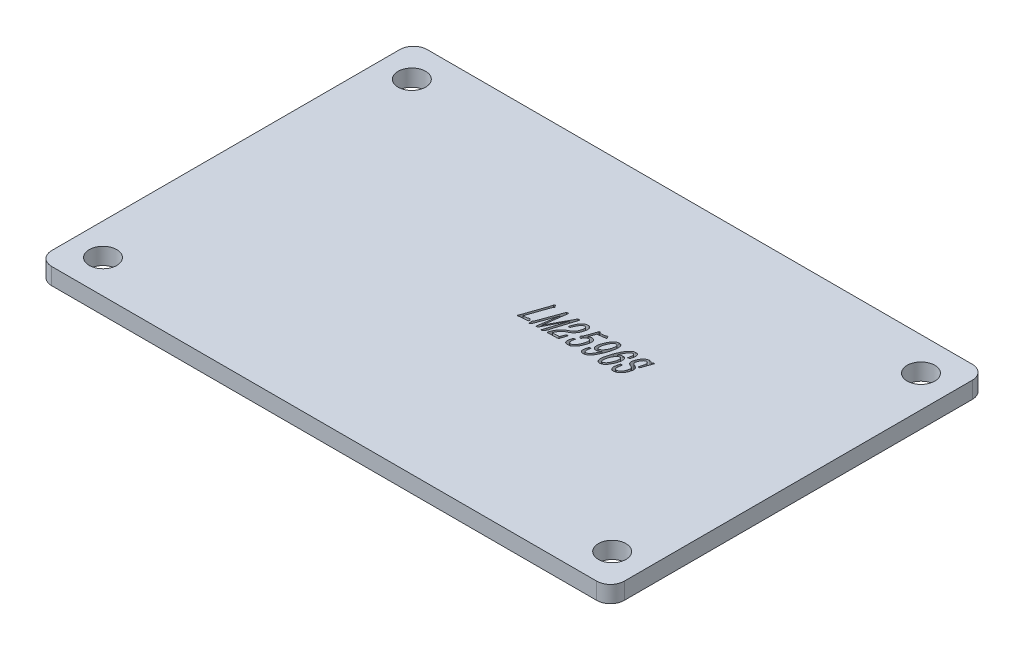
from build123d import *

# Parameters (mm, degrees)
SKETCH_1_R          = 1.65
EXTRUDE_1_DEPTH     = 2
CUT_EXTRUDE_START   = -1
CUT_EXTRUDE_1_DEPTH = 1


# Read off the part's stored shape, not the designer's step: 切除-拉伸1
with BuildPart() as part:
    # 草图1 → 凸台-拉伸1 (new body)
    with BuildSketch(Plane(origin=(0, 0, 0), x_dir=(1, 0, 0), z_dir=(0, 1, 0))):
        with BuildLine():
            Line((32.65, -22.5), (-32.65, -22.5))
            ThreePointArc((-32.65, -22.5), (-33.816726189, -22.016726189), (-34.3, -20.85))
            Line((-34.3, -20.85), (-34.3, 20.85))
            ThreePointArc((-34.3, 20.85), (-33.816726189, 22.016726189), (-32.65, 22.5))
            Line((-32.65, 22.5), (32.65, 22.5))
            ThreePointArc((32.65, 22.5), (33.816726189, 22.016726189), (34.3, 20.85))
            Line((34.3, 20.85), (34.3, -20.85))
            ThreePointArc((34.3, -20.85), (33.816726189, -22.016726189), (32.65, -22.5))
        make_face()
        with Locations(Location((-30.5, 18.5, 0), (0, 0, 270))):
            Circle(SKETCH_1_R, mode=Mode.SUBTRACT)
        with Locations(Location((30.5, 18.5, 0), (0, 0, 90))):
            Circle(SKETCH_1_R, mode=Mode.SUBTRACT)
        with Locations(Location((30.5, -18.5, 0), (0, 0, 270))):
            Circle(SKETCH_1_R, mode=Mode.SUBTRACT)
        with Locations(Location((-30.5, -18.5, 0), (0, 0, 90))):
            Circle(SKETCH_1_R, mode=Mode.SUBTRACT)
    extrude(amount=EXTRUDE_1_DEPTH)

    # 切除-拉伸1 outline → 切除-拉伸1 (cut)
    # profile 1 of 7: a face of its own
    with BuildSketch(Plane(origin=(0, 2, 0), x_dir=(1, 0, 0), z_dir=(0, 1, 0)).offset(CUT_EXTRUDE_START)):
        with BuildLine():
            add(Edge.make_bspline(
                [(11.319624973, 2.529725123), (11.326753338, 2.567830624), (11.339981513, 2.638543373), (11.363810052, 2.738810386), (11.386747264, 2.83309971), (11.402493277, 2.928406503), (11.408788686, 3.024022456), (11.40107061, 3.101456515), (11.384715065, 3.156938358), (11.369804851, 3.194089384), (11.348293758, 3.225207318), (11.322963493, 3.250684221), (11.294296694, 3.270288272), (11.263524636, 3.284015152), (11.230211949, 3.291074833), (11.184684427, 3.290006717), (11.129135658, 3.280496298), (11.076013715, 3.25837237), (11.034406929, 3.229718869), (10.996101664, 3.199008787), (10.95262477, 3.156252878), (10.901523079, 3.105345591), (10.847119389, 3.043543935), (10.792558439, 2.971198575), (10.736915044, 2.889534868), (10.664019856, 2.766635878), (10.576158329, 2.602847504), (10.499771775, 2.433051534), (10.445727973, 2.301323215), (10.421585689, 2.239116022), (10.410345271, 2.210525074)],
                knots=[0, 0, 0, 0, 0.048016888, 0.089105405, 0.127654772, 0.168210064, 0.208611881, 0.246125029, 0.263765638, 0.280183723, 0.295474126, 0.310282398, 0.324462469, 0.338252576, 0.351782306, 0.366256964, 0.394408992, 0.421179489, 0.436725185, 0.456877911, 0.481929832, 0.512200465, 0.546242109, 0.583815889, 0.624389886, 0.668597469, 0.76077153, 0.854490538, 0.899099648, 0.93715592, 0.93715592, 0.93715592, 0.93715592], degree=3))
            Line((11.319624973, 2.529725123), (11.486682293, 2.553590454))
            Line((11.486682293, 2.553590454), (11.542616663, 2.577455785))
            Line((11.542616663, 2.577455785), (11.59705945, 2.735563605))
            add(Edge.make_bspline(
                [(11.300980183, 3.558171745), (11.332938296, 3.55537961), (11.391604224, 3.55025405), (11.470752634, 3.530082967), (11.533066183, 3.499358127), (11.576123996, 3.457009642), (11.604543879, 3.412414193), (11.628279189, 3.371220088), (11.645918441, 3.332653625), (11.656575541, 3.294841352), (11.663922251, 3.255421395), (11.665904063, 3.210409655), (11.667264725, 3.158391127), (11.663279952, 3.101732242), (11.660194196, 3.045264039), (11.655589125, 2.993299452), (11.650667761, 2.948240187), (11.642153035, 2.894323663), (11.626748851, 2.823432882), (11.607663016, 2.766946106), (11.59705945, 2.735563605)],
                knots=[0, 0, 0, 0, 0.091586168, 0.168125935, 0.232336966, 0.287622003, 0.338278218, 0.383145194, 0.423552602, 0.459085297, 0.495189033, 0.537922916, 0.587673765, 0.643887342, 0.700141333, 0.749361491, 0.792995872, 0.829682411, 0.905376226, 1, 1, 1, 1], degree=3))
            add(Edge.make_bspline(
                [(10.078627743, 2.088962284), (10.092043775, 2.124514194), (10.117212009, 2.191208933), (10.152737815, 2.284990134), (10.185663794, 2.365405537), (10.225197569, 2.458460171), (10.279164702, 2.571015442), (10.346529938, 2.7098071), (10.422825779, 2.84851108), (10.4891655, 2.962189864), (10.547655064, 3.05014134), (10.597371436, 3.11763489), (10.654008389, 3.186987801), (10.714203242, 3.258491084), (10.779252353, 3.326433394), (10.846166624, 3.388282473), (10.915212273, 3.440367594), (10.984767437, 3.48551032), (11.058000786, 3.520567517), (11.135394035, 3.544224908), (11.216917438, 3.558489113), (11.272581603, 3.55827896), (11.300980183, 3.558171745)],
                knots=[0, 0, 0, 0, 0.056410835, 0.105825706, 0.14886341, 0.185400755, 0.255897094, 0.334127727, 0.414387224, 0.490842857, 0.529430594, 0.571134342, 0.615225599, 0.662339254, 0.709844425, 0.754777107, 0.797439761, 0.838085033, 0.877703722, 0.91750761, 0.957914275, 1, 1, 1, 1], degree=3))
            add(Edge.make_bspline(
                [(10.220328148, 0.281909227), (10.19249915, 0.280098745), (10.138454152, 0.276582721), (10.070837234, 0.287224422), (10.020300058, 0.307853057), (9.981584961, 0.329435729), (9.942445068, 0.358703245), (9.902806204, 0.393420868), (9.86591267, 0.435175841), (9.837901593, 0.485120934), (9.814521026, 0.539843172), (9.797351744, 0.623039326), (9.785413991, 0.73268396), (9.780797995, 0.847487699), (9.785600824, 0.948152915), (9.796865384, 1.037662616), (9.813201733, 1.140700776), (9.835695491, 1.251967632), (9.860700878, 1.361489032), (9.881452444, 1.45999998), (9.901360112, 1.541057249), (9.921795449, 1.627581379), (9.950036536, 1.724331764), (9.987162506, 1.839703457), (10.030604097, 1.961317245), (10.06209135, 2.045009175), (10.078627743, 2.088962284)],
                knots=[0, 0, 0, 0, 0.03956068, 0.07682838, 0.095843058, 0.116866224, 0.139607214, 0.165118082, 0.191658894, 0.218244295, 0.246111869, 0.275832629, 0.33841793, 0.402715898, 0.438774703, 0.481433334, 0.530775575, 0.586935239, 0.642621152, 0.690341085, 0.729908068, 0.761166336, 0.816603174, 0.872993246, 0.933298924, 1, 1, 1, 1], degree=3))
            add(Edge.make_bspline(
                [(11.068293203, 1.084380993), (11.053872372, 1.05541355), (11.023329038, 0.994060479), (10.969919402, 0.900045656), (10.909148123, 0.797266792), (10.842698841, 0.689580228), (10.77067729, 0.585020153), (10.689912589, 0.496193855), (10.604071033, 0.425272911), (10.514549478, 0.373835141), (10.428409541, 0.337241697), (10.350739054, 0.30914977), (10.282885658, 0.289066112), (10.239814747, 0.284138589), (10.220328148, 0.281909227)],
                knots=[0, 0, 0, 0, 0.079263847, 0.167880907, 0.264814542, 0.371790082, 0.477921398, 0.575347443, 0.664953156, 0.749565857, 0.827301008, 0.893958514, 0.952023584, 1, 1, 1, 1], degree=3))
            add(Edge.make_bspline(
                [(10.866929469, 2.42158534), (10.886589109, 2.42118425), (10.924292828, 2.420415029), (10.978317607, 2.413823439), (11.027127036, 2.402341257), (11.0704245, 2.384465457), (11.110126107, 2.363025804), (11.145250427, 2.334657677), (11.177822239, 2.301762803), (11.206196623, 2.262416031), (11.230840866, 2.217275717), (11.251560663, 2.166182107), (11.268932178, 2.109090825), (11.285125994, 2.024054569), (11.296537056, 1.911174741), (11.289262569, 1.794565371), (11.274634537, 1.697461188), (11.256960519, 1.617881049), (11.23389369, 1.53225165), (11.19483815, 1.411518301), (11.141690833, 1.260480826), (11.092451101, 1.142342016), (11.068293203, 1.084380993)],
                knots=[0, 0, 0, 0, 0.036382012, 0.069774277, 0.100580197, 0.128866596, 0.156266865, 0.183794371, 0.212106964, 0.241746136, 0.273258923, 0.307101626, 0.343643368, 0.383535045, 0.467197852, 0.552918689, 0.598998486, 0.648914818, 0.703726948, 0.763108811, 0.883776925, 1, 1, 1, 1], degree=3))
            add(Edge.make_bspline(
                [(10.410345271, 2.210525074), (10.416050186, 2.215819905), (10.449129723, 2.245792172), (10.515387249, 2.296635031), (10.596944633, 2.34739101), (10.669961017, 2.38141985), (10.730958103, 2.401452348), (10.797361446, 2.414729849), (10.843260597, 2.419252922), (10.866929469, 2.42158534)],
                knots=[0.404971471, 0.404971471, 0.404971471, 0.404971471, 0.432023627, 0.560128766, 0.694717093, 0.765101066, 0.83971451, 0.917345382, 1, 1, 1, 1], degree=3))
        make_face()
        with BuildLine():
            add(Edge.make_bspline(
                [(10.78340081, 2.144150863), (10.773100017, 2.142556458), (10.750618648, 2.139076688), (10.716027357, 2.124014401), (10.676728769, 2.104229335), (10.61950773, 2.068122267), (10.549209543, 2.014286204), (10.485947564, 1.949276583), (10.438225331, 1.889966685), (10.402168059, 1.836055129), (10.362124324, 1.775401551), (10.32250004, 1.70543497), (10.282350459, 1.628120598), (10.242879966, 1.544201096), (10.20537119, 1.453333549), (10.182767084, 1.390009052), (10.171105902, 1.35734072)],
                knots=[0, 0, 0, 0, 0.030109941, 0.065714622, 0.108588335, 0.157792871, 0.261597461, 0.364557771, 0.419941904, 0.482122806, 0.552499195, 0.630638236, 0.715103682, 0.805067532, 0.89943673, 1, 1, 1, 1], degree=3))
            add(Edge.make_bspline(
                [(10.994459834, 1.706371191), (10.996023434, 1.727987763), (10.999094338, 1.770442601), (10.998155227, 1.83301138), (10.993304701, 1.893197713), (10.982810117, 1.949506966), (10.969352689, 2.000724278), (10.95159455, 2.044118522), (10.930889814, 2.079967855), (10.905013561, 2.106412307), (10.876785311, 2.125274258), (10.847149319, 2.138714329), (10.815442897, 2.144403173), (10.79410278, 2.144235134), (10.78340081, 2.144150863)],
                knots=[0, 0, 0, 0, 0.117814531, 0.231387145, 0.339957123, 0.445764662, 0.542521874, 0.627383564, 0.700188791, 0.766158301, 0.826528991, 0.884046869, 0.941850039, 1, 1, 1, 1], degree=3))
            add(Edge.make_bspline(
                [(10.261346687, 0.559343703), (10.277116988, 0.561036132), (10.310050452, 0.564570469), (10.359697313, 0.581371719), (10.411370211, 0.606364875), (10.464387545, 0.639656708), (10.516258175, 0.68049559), (10.566448783, 0.725344467), (10.611522599, 0.776372283), (10.667831669, 0.851112799), (10.731329902, 0.95619793), (10.795934626, 1.094643622), (10.855107472, 1.241413379), (10.915663077, 1.390752272), (10.967307612, 1.545247184), (10.985397457, 1.652594138), (10.994459834, 1.706371191)],
                knots=[0, 0, 0, 0, 0.033065291, 0.069050969, 0.108790502, 0.152905102, 0.19956824, 0.246646067, 0.293375687, 0.341592316, 0.442107469, 0.549241177, 0.660589479, 0.772799957, 0.88618076, 1, 1, 1, 1], degree=3))
            add(Edge.make_bspline(
                [(10.171105902, 1.35734072), (10.157214891, 1.313537581), (10.128946777, 1.22439849), (10.099911739, 1.087160277), (10.082936778, 0.949425392), (10.081717538, 0.837543122), (10.089357472, 0.754881106), (10.09924336, 0.701098577), (10.115046922, 0.655622102), (10.133766577, 0.617106754), (10.158955138, 0.587815623), (10.18889873, 0.567377888), (10.224199621, 0.557126412), (10.248618264, 0.55858395), (10.261346687, 0.559343703)],
                knots=[0, 0, 0, 0, 0.152325287, 0.309980926, 0.464393534, 0.611968529, 0.679892627, 0.739554139, 0.792740957, 0.839202455, 0.880695047, 0.919337794, 0.957954149, 1, 1, 1, 1], degree=3))
        make_face(mode=Mode.SUBTRACT)
    # profile 2 of 7: a face of its own
    with BuildSketch(Plane(origin=(0, 2, 0), x_dir=(1, 0, 0), z_dir=(0, 1, 0)).offset(CUT_EXTRUDE_START)):
        with BuildLine():
            add(Edge.make_bspline(
                [(12.912635841, 3.567867036), (12.939142799, 3.565233706), (12.990134196, 3.560167972), (13.061479373, 3.539212889), (13.125736341, 3.511504093), (13.179321881, 3.472634465), (13.224573033, 3.431830655), (13.258620007, 3.394250591), (13.275885689, 3.369629077), (13.28190395, 3.359344784)],
                knots=[0, 0, 0, 0, 0.160913397, 0.309548871, 0.448301289, 0.582320695, 0.708056454, 0.8167907, 0.888918404, 0.888918404, 0.888918404, 0.888918404], degree=3))
            add(Edge.make_bspline(
                [(12.028872789, 2.730343064), (12.037961875, 2.756585471), (12.05554781, 2.807360352), (12.086989767, 2.878979592), (12.11750693, 2.945449357), (12.162163511, 3.025869263), (12.224268655, 3.12064819), (12.306016893, 3.227829835), (12.393614077, 3.323941803), (12.484290088, 3.405999762), (12.578963013, 3.471260438), (12.661240331, 3.516590821), (12.73159073, 3.543940104), (12.788797484, 3.557595487), (12.849411885, 3.567266944), (12.891215329, 3.567663723), (12.912635841, 3.567867036)],
                knots=[0, 0, 0, 0, 0.064498195, 0.12479374, 0.181637338, 0.234373753, 0.338350867, 0.444636662, 0.547250782, 0.640116115, 0.728083073, 0.81387459, 0.857749845, 0.902998931, 0.950295664, 1, 1, 1, 1], degree=3))
            add(Edge.make_bspline(
                [(12.213829107, 1.920413382), (12.18380199, 1.935425676), (12.124665966, 1.964991197), (12.061289845, 2.0182297), (12.019942917, 2.06725959), (11.994543204, 2.10732764), (11.973202676, 2.150129614), (11.957629324, 2.196825794), (11.947181788, 2.247139404), (11.942356007, 2.301149805), (11.941503127, 2.358766382), (11.94621769, 2.42089776), (11.956966845, 2.488708612), (11.974384709, 2.5631426), (11.998467725, 2.64475035), (12.018397516, 2.700854323), (12.028872789, 2.730343064)],
                knots=[0, 0, 0, 0, 0.107404064, 0.211523776, 0.262460483, 0.312661898, 0.363291962, 0.415479857, 0.470049255, 0.527721881, 0.589115285, 0.654664533, 0.727279933, 0.809086455, 0.899654161, 1, 1, 1, 1], degree=3))
            Line((12.213829107, 1.920413382), (12.398039633, 1.841359472))
            add(Edge.make_bspline(
                [(12.585233326, 1.240251438), (12.594400313, 1.274448647), (12.611296104, 1.33747796), (12.62795106, 1.425432934), (12.636008327, 1.498379763), (12.633269717, 1.558239262), (12.622779176, 1.608147262), (12.608581966, 1.652170455), (12.587575031, 1.690922305), (12.562719839, 1.726194961), (12.531116406, 1.757888149), (12.493380693, 1.787946863), (12.448445071, 1.816124798), (12.415345898, 1.832695368), (12.398039633, 1.841359472)],
                knots=[0, 0, 0, 0, 0.149796169, 0.276091238, 0.378589772, 0.459715849, 0.528429664, 0.593977199, 0.65469369, 0.714259707, 0.776015707, 0.843387247, 0.918113307, 1, 1, 1, 1], degree=3))
            add(Edge.make_bspline(
                [(11.931174089, 0.574259535), (11.95160895, 0.574956763), (11.991801323, 0.576328107), (12.050331783, 0.58771282), (12.10533799, 0.6066983), (12.15778136, 0.632425154), (12.207284117, 0.665796263), (12.256453349, 0.704089904), (12.304001843, 0.748899201), (12.363583365, 0.815241572), (12.430281098, 0.898970165), (12.494124356, 1.005113843), (12.545134858, 1.117985543), (12.571358469, 1.197945037), (12.585233326, 1.240251438)],
                knots=[0, 0, 0, 0, 0.06157663, 0.121112194, 0.178948509, 0.236604839, 0.296685232, 0.358612133, 0.424367126, 0.493341319, 0.627383728, 0.746417103, 0.865829817, 1, 1, 1, 1], degree=3))
            add(Edge.make_bspline(
                [(11.776795227, 1.46398892), (11.768461383, 1.425980908), (11.752797092, 1.354541058), (11.732683638, 1.253544708), (11.716322288, 1.165770154), (11.699399386, 1.069455772), (11.687113395, 0.964430817), (11.688733634, 0.867064956), (11.697142974, 0.79769926), (11.708995673, 0.75251395), (11.722406268, 0.711364334), (11.740619482, 0.675611471), (11.760390674, 0.644836582), (11.782109829, 0.620379129), (11.803881566, 0.600607911), (11.835200511, 0.58383917), (11.878312409, 0.573425255), (11.913231895, 0.573976366), (11.931174089, 0.574259535)],
                knots=[0, 0, 0, 0, 0.112864024, 0.212139198, 0.298694179, 0.371837857, 0.495825715, 0.604731979, 0.653479027, 0.698076056, 0.740035884, 0.7787337, 0.814133331, 0.845812142, 0.873421557, 0.898915982, 0.948061405, 1, 1, 1, 1], degree=3))
            Line((11.776795227, 1.46398892), (11.570956744, 1.46398892))
            Line((11.570956744, 1.46398892), (11.482207543, 1.151502237))
            add(Edge.make_bspline(
                [(11.846153846, 0.291604517), (11.821507506, 0.291672515), (11.774402182, 0.291802474), (11.707229629, 0.302668781), (11.647908365, 0.323792617), (11.596166803, 0.353871173), (11.552693807, 0.393226045), (11.514008461, 0.437883281), (11.483088935, 0.490364957), (11.45641734, 0.548064989), (11.437405549, 0.612114312), (11.425614494, 0.681715451), (11.420595756, 0.756164709), (11.423124823, 0.861840183), (11.43937617, 0.995682807), (11.468003001, 1.099826479), (11.482207543, 1.151502237)],
                knots=[0, 0, 0, 0, 0.066209553, 0.126543031, 0.181941951, 0.234679622, 0.286308345, 0.338948483, 0.392946326, 0.449486953, 0.509545765, 0.57196873, 0.638979959, 0.709851081, 0.856029028, 1, 1, 1, 1], degree=3))
            add(Edge.make_bspline(
                [(12.716492649, 0.886746218), (12.690673631, 0.843535161), (12.639155802, 0.757314228), (12.560012956, 0.660765442), (12.494157344, 0.590048647), (12.446439371, 0.542235389), (12.400473609, 0.499550612), (12.354670103, 0.462173232), (12.307160045, 0.427820804), (12.25390394, 0.397983566), (12.195658355, 0.36856258), (12.132248815, 0.342013207), (12.064574224, 0.319473968), (11.993939972, 0.303210907), (11.920780395, 0.293064213), (11.871295667, 0.292096292), (11.846153846, 0.291604517)],
                knots=[0, 0, 0, 0, 0.136340092, 0.272045418, 0.337393071, 0.398407192, 0.455181305, 0.507402547, 0.558653188, 0.613922574, 0.672710074, 0.735558621, 0.800150866, 0.865886795, 0.931860792, 1, 1, 1, 1], degree=3))
            add(Edge.make_bspline(
                [(12.603878116, 2.121777115), (12.625624731, 2.110055924), (12.666928449, 2.087793665), (12.723661478, 2.052989545), (12.771789988, 2.018606704), (12.823834543, 1.974915948), (12.876279106, 1.915606015), (12.913094756, 1.847682595), (12.93267358, 1.790038621), (12.943825739, 1.74470064), (12.947642368, 1.696750531), (12.947439011, 1.629122814), (12.93803875, 1.540489915), (12.922539072, 1.449199842), (12.903377024, 1.372394865), (12.887292499, 1.308688575), (12.865934129, 1.241147333), (12.835749131, 1.144635294), (12.79080682, 1.023351055), (12.741226002, 0.932211244), (12.716492649, 0.886746218)],
                knots=[0, 0, 0, 0, 0.051978856, 0.098724335, 0.139954766, 0.176325786, 0.241579757, 0.305248117, 0.337342347, 0.369572714, 0.403199264, 0.438248371, 0.511800373, 0.590407898, 0.632912887, 0.678337143, 0.72864387, 0.781914954, 0.891208439, 1, 1, 1, 1], degree=3))
            Line((12.603878116, 2.121777115), (12.451736629, 2.191881526))
            add(Edge.make_bspline(
                [(12.251864479, 2.420839548), (12.25546024, 2.402259087), (12.262116354, 2.367864795), (12.280672021, 2.321957054), (12.302840436, 2.284124567), (12.341964771, 2.250166174), (12.392119568, 2.220779682), (12.432728901, 2.201095135), (12.451736629, 2.191881526)],
                knots=[0, 0, 0, 0, 0.175867707, 0.325548712, 0.459851584, 0.579514817, 0.803186428, 1, 1, 1, 1], degree=3))
            add(Edge.make_bspline(
                [(12.827615598, 3.290432559), (12.817908102, 3.289873934), (12.796811475, 3.288659913), (12.768800737, 3.283484538), (12.742880056, 3.273587179), (12.717635925, 3.261203579), (12.687516093, 3.243071278), (12.638434899, 3.211799257), (12.573729795, 3.160269146), (12.503974029, 3.081081866), (12.440608573, 2.992377615), (12.393744172, 2.913555877), (12.361985839, 2.845783376), (12.33736252, 2.789834611), (12.312076152, 2.727980931), (12.287128503, 2.662429917), (12.266514629, 2.596339869), (12.252249856, 2.533358423), (12.24732849, 2.475025625), (12.250408657, 2.438230529), (12.251864479, 2.420839548)],
                knots=[0, 0, 0, 0, 0.02615902, 0.056849589, 0.07610501, 0.100631584, 0.132403363, 0.17061691, 0.257201114, 0.353786648, 0.453453338, 0.550260886, 0.599916659, 0.654714876, 0.714699339, 0.779666327, 0.843339964, 0.900791803, 0.953109843, 1, 1, 1, 1], degree=3))
            add(Edge.make_bspline(
                [(13.052844662, 2.761666312), (13.058173498, 2.789455577), (13.067940833, 2.840391112), (13.076337384, 2.910439693), (13.082173791, 2.966656911), (13.080289229, 3.022987276), (13.06815402, 3.08223188), (13.044263646, 3.146477292), (13.006166289, 3.203274921), (12.955389906, 3.248171568), (12.895185746, 3.281983749), (12.850160063, 3.287613653), (12.827615598, 3.290432559)],
                knots=[0, 0, 0, 0, 0.128213972, 0.235006107, 0.319796701, 0.384071856, 0.489716169, 0.592471914, 0.693117255, 0.796064391, 0.897888965, 1, 1, 1, 1], degree=3))
            Line((13.052844662, 2.761666312), (12.895482634, 2.19859365))
            Line((12.895482634, 2.19859365), (13.099083742, 2.211272107))
            Line((13.099083742, 2.211272107), (13.553270829, 3.524611123))
            Line((13.553270829, 3.524611123), (13.373535052, 3.539526955))
            Line((13.373535052, 3.539526955), (13.28190395, 3.359344784))
        make_face()
    # profile 3 of 7: a face of its own
    with BuildSketch(Plane(origin=(0, 2, 0), x_dir=(1, 0, 0), z_dir=(0, 1, 0)).offset(CUT_EXTRUDE_START)):
        with BuildLine():
            add(Edge.make_bspline(
                [(4.518751332, 2.1941189), (4.52742417, 2.224704013), (4.543586905, 2.281702542), (4.56654992, 2.361132264), (4.587435472, 2.42793498), (4.611929362, 2.503501881), (4.646526277, 2.594316086), (4.67664378, 2.666295228), (4.692520776, 2.704240358)],
                knots=[0, 0, 0, 0, 0.176806308, 0.329496897, 0.459810584, 0.566052454, 0.77123656, 1, 1, 1, 1], degree=3))
            Line((4.518751332, 2.1941189), (4.694012359, 2.217984232))
            Line((4.694012359, 2.217984232), (4.748455146, 2.241103772))
            Line((4.748455146, 2.241103772), (4.808118474, 2.402194758))
            add(Edge.make_bspline(
                [(5.501704667, 3.241210313), (5.482379308, 3.240757185), (5.439944116, 3.239762191), (5.374292699, 3.21333138), (5.303012143, 3.170582731), (5.227738787, 3.109611004), (5.150875726, 3.032289377), (5.078006004, 2.936860027), (5.006798145, 2.824648378), (4.936411066, 2.696335254), (4.86826172, 2.554061095), (4.828402329, 2.453413057), (4.808118474, 2.402194758)],
                knots=[0, 0, 0, 0, 0.050563255, 0.111028292, 0.18322451, 0.269416453, 0.365243966, 0.469747148, 0.584883573, 0.714985691, 0.85496043, 1, 1, 1, 1], degree=3))
            add(Edge.make_bspline(
                [(5.700085233, 2.843703388), (5.702760308, 2.870021391), (5.707874552, 2.920336507), (5.70832801, 2.99333408), (5.700560048, 3.059541133), (5.688387067, 3.11918998), (5.665665647, 3.172021345), (5.623381091, 3.210604938), (5.567076911, 3.234856875), (5.524595988, 3.238985537), (5.501704667, 3.241210313)],
                knots=[0, 0, 0, 0, 0.154058382, 0.294530913, 0.424229108, 0.541566664, 0.649092709, 0.752563447, 0.866666044, 1, 1, 1, 1], degree=3))
            add(Edge.make_bspline(
                [(5.119113573, 1.891327509), (5.137899638, 1.901021344), (5.174046093, 1.919673349), (5.223813272, 1.950516435), (5.268579282, 1.980772805), (5.308239823, 2.014571505), (5.347364494, 2.053553536), (5.387403985, 2.102337589), (5.429373945, 2.162612276), (5.490308836, 2.254276533), (5.559846289, 2.376167772), (5.624751363, 2.528763989), (5.6732433, 2.683894653), (5.691103931, 2.790231434), (5.700085233, 2.843703388)],
                knots=[0, 0, 0, 0, 0.05476668, 0.105377116, 0.151669174, 0.194650271, 0.240210143, 0.294657526, 0.357948043, 0.430501334, 0.579948825, 0.72081211, 0.859609046, 1, 1, 1, 1], degree=3))
            Line((5.119113573, 1.891327509), (4.873002344, 1.763051353))
            add(Edge.make_bspline(
                [(4.026528873, 0.838269763), (4.053436719, 0.893321497), (4.104223711, 0.99722844), (4.186161234, 1.13827915), (4.266099643, 1.256681798), (4.346582779, 1.351995827), (4.424112839, 1.429631638), (4.494949772, 1.497370541), (4.560862148, 1.554686162), (4.642469506, 1.617984485), (4.745186989, 1.687597609), (4.829968468, 1.737646995), (4.873002344, 1.763051353)],
                knots=[0, 0, 0, 0, 0.143839333, 0.271488367, 0.382722806, 0.478837322, 0.563869028, 0.640256739, 0.708952998, 0.768852387, 0.882672751, 1, 1, 1, 1], degree=3))
            add(Edge.make_bspline(
                [(3.969848711, 0.331131472), (3.958861911, 0.330771559), (3.939028006, 0.330121826), (3.912017273, 0.337515829), (3.891466092, 0.352157542), (3.880298429, 0.376235534), (3.878830794, 0.407793192), (3.882801393, 0.448523238), (3.89595605, 0.499146405), (3.921493786, 0.582842534), (3.965870906, 0.697211517), (4.00584785, 0.790176677), (4.026528873, 0.838269763)],
                knots=[0, 0, 0, 0, 0.055062309, 0.09940116, 0.138686278, 0.177851686, 0.228145004, 0.295993015, 0.383390618, 0.490642207, 0.736497112, 1, 1, 1, 1], degree=3))
            Line((3.969848711, 0.331131472), (4.955785212, 0.355742595))
            add(Edge.make_bspline(
                [(5.265288728, 0.553377371), (5.261278348, 0.539966515), (5.254294301, 0.516611612), (5.245518009, 0.485792342), (5.238170034, 0.465080135), (5.231479678, 0.446252079), (5.213569852, 0.425065122), (5.193249486, 0.396911338), (5.156182621, 0.373587741), (5.105742147, 0.364690038), (5.037665859, 0.35589756), (4.98518622, 0.355798239), (4.955785212, 0.355742595)],
                knots=[0, 0, 0, 0, 0.100483591, 0.174991401, 0.22972114, 0.258544779, 0.317448375, 0.426207677, 0.506394728, 0.62409379, 0.789403632, 1, 1, 1, 1], degree=3))
            Line((5.265288728, 0.553377371), (5.480822502, 1.251438312))
            Line((5.480822502, 1.251438312), (5.273492436, 1.251438312))
            Line((5.273492436, 1.251438312), (5.091519284, 0.786064351))
            add(Edge.make_bspline(
                [(5.012465374, 0.642872363), (5.015280268, 0.643394819), (5.020563987, 0.6443755), (5.028521261, 0.650370967), (5.034430882, 0.666113687), (5.04811039, 0.691825755), (5.067938047, 0.733654665), (5.082897328, 0.766901914), (5.091519284, 0.786064351)],
                knots=[0, 0, 0, 0, 0.050886524, 0.095516957, 0.171388695, 0.345046395, 0.622509892, 1, 1, 1, 1], degree=3))
            Line((5.012465374, 0.642872363), (4.21595994, 0.614532282))
            Line((4.21595994, 0.614532282), (4.280098018, 0.772640102))
            add(Edge.make_bspline(
                [(4.915512465, 1.508736416), (4.886179417, 1.492742657), (4.827048838, 1.460501882), (4.742868179, 1.40457342), (4.662415969, 1.34381028), (4.591968595, 1.273672462), (4.528541807, 1.198981821), (4.468398884, 1.120471794), (4.412177336, 1.03414168), (4.359633601, 0.943454614), (4.313400772, 0.85614754), (4.29038255, 0.798428807), (4.280098018, 0.772640102)],
                knots=[0, 0, 0, 0, 0.100736605, 0.203068347, 0.304619499, 0.404315168, 0.502166149, 0.60010617, 0.702437912, 0.812664409, 0.91629854, 1, 1, 1, 1], degree=3))
            Line((4.915512465, 1.508736416), (5.22427019, 1.668335819))
            add(Edge.make_bspline(
                [(5.814191349, 2.308970808), (5.791326086, 2.265279153), (5.74440479, 2.175620482), (5.660051753, 2.049790865), (5.569560284, 1.933450682), (5.486922509, 1.848915338), (5.415063521, 1.792483145), (5.357403798, 1.750233432), (5.293240909, 1.7087072), (5.247746119, 1.68207724), (5.22427019, 1.668335819)],
                knots=[0, 0, 0, 0, 0.166927441, 0.34254808, 0.512188802, 0.665802747, 0.741285181, 0.821454804, 0.907868257, 1, 1, 1, 1], degree=3))
            add(Edge.make_bspline(
                [(5.599403367, 3.538781163), (5.621606813, 3.537117835), (5.664163567, 3.533929778), (5.724784762, 3.520095975), (5.77974091, 3.500313212), (5.828236662, 3.473041702), (5.871005934, 3.441647552), (5.907828012, 3.406681898), (5.938077474, 3.367773107), (5.963172818, 3.325862973), (5.98165253, 3.278828985), (5.996994737, 3.227832865), (6.005073695, 3.171067425), (6.012231251, 3.090010012), (6.009783094, 2.984777885), (5.991678271, 2.856561809), (5.960244821, 2.722605303), (5.919428998, 2.582902167), (5.872535809, 2.44222348), (5.833237055, 2.352469217), (5.814191349, 2.308970808)],
                knots=[0, 0, 0, 0, 0.044636197, 0.085553007, 0.124390622, 0.161466956, 0.196796398, 0.230676006, 0.263017811, 0.295451868, 0.328347086, 0.364194254, 0.402094164, 0.443159791, 0.527501624, 0.612607545, 0.702668551, 0.803424088, 0.90473166, 1, 1, 1, 1], degree=3))
            add(Edge.make_bspline(
                [(4.692520776, 2.704240358), (4.704829383, 2.733376157), (4.728738936, 2.789972648), (4.765412737, 2.871250639), (4.804124408, 2.945167471), (4.842430538, 3.015645801), (4.887979964, 3.083425056), (4.941301867, 3.153346275), (5.005153812, 3.226019045), (5.075500384, 3.300468462), (5.149721381, 3.37039397), (5.225927168, 3.427121407), (5.299901943, 3.471287233), (5.372992327, 3.498431741), (5.440596807, 3.514994961), (5.500260261, 3.529354022), (5.552450691, 3.537226083), (5.58471661, 3.538294735), (5.599403367, 3.538781163)],
                knots=[0, 0, 0, 0, 0.072714776, 0.141248954, 0.204893109, 0.264509684, 0.325534037, 0.392401429, 0.466539591, 0.547790467, 0.627869174, 0.700563736, 0.765849414, 0.825180425, 0.878964782, 0.925827397, 0.966238217, 1, 1, 1, 1], degree=3))
        make_face()
    # profile 4 of 7: a face of its own
    with BuildSketch(Plane(origin=(0, 2, 0), x_dir=(1, 0, 0), z_dir=(0, 1, 0)).offset(CUT_EXTRUDE_START)):
        with BuildLine():
            add(Edge.make_bspline(
                [(3.759535478, 1.011293416), (3.754922021, 0.998411394), (3.74635742, 0.974496709), (3.736445384, 0.940605878), (3.726816458, 0.912364054), (3.719112619, 0.881013608), (3.713109845, 0.845126386), (3.707546363, 0.804614334), (3.706058766, 0.766926656), (3.707628046, 0.734019354), (3.710731277, 0.705928575), (3.710755684, 0.681837677), (3.700151773, 0.65791386), (3.682268159, 0.628493151), (3.65475747, 0.586082516), (3.632149433, 0.554268415), (3.619326657, 0.536224164)],
                knots=[0, 0, 0, 0, 0.080753431, 0.149913804, 0.20839393, 0.25679974, 0.340280675, 0.42310116, 0.498002039, 0.562639444, 0.617115751, 0.66563266, 0.701877649, 0.769590465, 0.869316836, 1, 1, 1, 1], degree=3))
            Line((3.759535478, 1.011293416), (3.828894098, 1.229064564))
            Line((3.828894098, 1.229064564), (4.577668869, 3.593969742))
            Line((4.577668869, 3.593969742), (4.332303431, 3.593969742))
            Line((4.332303431, 3.593969742), (2.815363307, 0.797251225))
            Line((2.815363307, 0.797251225), (3.200191775, 3.593969742))
            Line((3.200191775, 3.593969742), (2.951097379, 3.593969742))
            Line((2.951097379, 3.593969742), (2.087470701, 1.20370765))
            add(Edge.make_bspline(
                [(1.799595142, 0.566055828), (1.801478516, 0.581109529), (1.805173922, 0.610646704), (1.821543585, 0.653578281), (1.845429282, 0.696107861), (1.875545933, 0.736707605), (1.901000571, 0.773152741), (1.921166344, 0.796774711), (1.931063669, 0.815674908), (1.941339048, 0.833170877), (1.950847183, 0.858589935), (1.964007402, 0.887240928), (1.975192454, 0.917106232), (1.986828891, 0.942058714), (1.994834316, 0.961643085), (2.000845452, 0.975295176), (2.006468186, 0.986958971), (2.010972758, 1.001370544), (2.020147647, 1.020673065), (2.028983008, 1.046375699), (2.040498312, 1.077755243), (2.054689916, 1.114356101), (2.070250625, 1.157244706), (2.081484634, 1.187556135), (2.087470701, 1.20370765)],
                knots=[0, 0, 0, 0, 0.064362733, 0.126287432, 0.194015174, 0.271510944, 0.341137925, 0.383462597, 0.40288704, 0.431768008, 0.469698212, 0.518048477, 0.565991795, 0.60531333, 0.635185225, 0.656027709, 0.668812983, 0.690238215, 0.72011011, 0.759616287, 0.805811297, 0.862408184, 0.926683881, 1, 1, 1, 1], degree=3))
            Line((1.799595142, 0.566055828), (1.811527807, 0.348284679))
            add(Edge.make_bspline(
                [(1.857766887, 0.198380567), (1.851709489, 0.199225064), (1.838525031, 0.201063186), (1.822736888, 0.211024146), (1.814233273, 0.226009088), (1.80992754, 0.242607416), (1.808149201, 0.263963083), (1.808153466, 0.288405989), (1.810231987, 0.311719688), (1.8103767, 0.330155913), (1.811603477, 0.341561625), (1.811544602, 0.346792507), (1.811527807, 0.348284679)],
                knots=[0, 0, 0, 0, 0.103457675, 0.225184737, 0.299006802, 0.391175757, 0.514212532, 0.661916962, 0.805649294, 0.911236827, 0.974679241, 1, 1, 1, 1], degree=3))
            add(Edge.make_bspline(
                [(2.066588536, 0.401981675), (2.057289988, 0.378448997), (2.038176198, 0.330075993), (2.007974543, 0.272172839), (1.975065965, 0.230566669), (1.9416431, 0.209155613), (1.901537391, 0.197425234), (1.873012571, 0.198047815), (1.857766887, 0.198380567)],
                knots=[0, 0, 0, 0, 0.238225779, 0.489689114, 0.612577651, 0.732692637, 0.85713202, 1, 1, 1, 1], degree=3))
            Line((2.066588536, 0.401981675), (2.181440443, 0.707756233))
            Line((2.181440443, 0.707756233), (2.933198381, 2.796718517))
            Line((2.933198381, 2.796718517), (2.552098871, 0.322927765))
            Line((2.552098871, 0.322927765), (2.76539527, 0.31621564))
            Line((2.76539527, 0.31621564), (4.072767952, 2.826550181))
            Line((4.072767952, 2.826550181), (3.391860217, 0.733113147))
            Line((3.391860217, 0.733113147), (3.2956531, 0.427338589))
            add(Edge.make_bspline(
                [(3.244939271, 0.252077562), (3.244076606, 0.259799804), (3.241797935, 0.280197582), (3.251889389, 0.317902753), (3.270134432, 0.368247272), (3.286452101, 0.406032651), (3.2956531, 0.427338589)],
                knots=[0, 0, 0, 0, 0.125565402, 0.331672527, 0.62315202, 1, 1, 1, 1], degree=3))
            add(Edge.make_bspline(
                [(3.505966333, 0.367675261), (3.494455365, 0.352371298), (3.473086616, 0.323961301), (3.441222414, 0.286856075), (3.413111385, 0.257719643), (3.380532249, 0.232438728), (3.340231313, 0.213403669), (3.298816062, 0.211295154), (3.271163782, 0.218107417), (3.255222616, 0.225191195), (3.245742075, 0.237650105), (3.245209847, 0.24721496), (3.244939271, 0.252077562)],
                knots=[0, 0, 0, 0, 0.167159473, 0.310311779, 0.426966479, 0.519877317, 0.66953105, 0.808609623, 0.871260354, 0.917867672, 0.958245383, 1, 1, 1, 1], degree=3))
            Line((3.505966333, 0.367675261), (3.619326657, 0.536224164))
        make_face()
    # profile 5 of 7: a face of its own
    with BuildSketch(Plane(origin=(0, 2, 0), x_dir=(1, 0, 0), z_dir=(0, 1, 0)).offset(CUT_EXTRUDE_START)):
        with BuildLine():
            add(Edge.make_bspline(
                [(8.173130194, 1.330492222), (8.166894798, 1.308621546), (8.155069895, 1.267145657), (8.138549738, 1.208008235), (8.124438148, 1.155602287), (8.108655453, 1.092787365), (8.094295896, 1.01296145), (8.080777408, 0.913586682), (8.079345091, 0.811612797), (8.09436686, 0.730672762), (8.11429414, 0.673670829), (8.132475538, 0.637579853), (8.152126106, 0.606758143), (8.175038714, 0.581792848), (8.201963299, 0.56321907), (8.232933859, 0.551493521), (8.267583981, 0.545446051), (8.318167708, 0.546039829), (8.382422177, 0.559227076), (8.445312536, 0.58461919), (8.495638299, 0.616263735), (8.537811208, 0.651702113), (8.586463067, 0.695589767), (8.639578203, 0.749800444), (8.695930399, 0.813291133), (8.752541297, 0.886492586), (8.808448958, 0.969303025), (8.88490698, 1.093203941), (8.976387241, 1.264043175), (9.040871557, 1.407885921), (9.074046452, 1.481887918)],
                knots=[0, 0, 0, 0, 0.031366226, 0.059483398, 0.084683528, 0.106221462, 0.148788073, 0.196461362, 0.24446272, 0.288777514, 0.309165842, 0.327566008, 0.344397941, 0.359437255, 0.373987904, 0.38907794, 0.404748868, 0.422235077, 0.458546602, 0.494521488, 0.515164806, 0.540278486, 0.570376649, 0.605531788, 0.644882388, 0.687403406, 0.733051076, 0.782624689, 0.888168104, 1, 1, 1, 1], degree=3))
            Line((8.173130194, 1.330492222), (8.052311954, 1.306626891))
            Line((8.052311954, 1.306626891), (7.948646921, 1.28276156))
            Line((7.948646921, 1.28276156), (7.912103132, 1.178350735))
            add(Edge.make_bspline(
                [(8.181333902, 0.286383976), (8.160873666, 0.287822735), (8.121073492, 0.290621473), (8.063836046, 0.303910993), (8.010486217, 0.322243319), (7.961800028, 0.347319489), (7.91916732, 0.379912558), (7.883330414, 0.419807162), (7.856737613, 0.46805384), (7.836253817, 0.522255179), (7.824358058, 0.583244383), (7.817712204, 0.649658727), (7.817279749, 0.721767588), (7.822556648, 0.799812335), (7.834986598, 0.884454896), (7.853510647, 0.976180713), (7.880369844, 1.07491894), (7.901215147, 1.142862327), (7.912103132, 1.178350735)],
                knots=[0, 0, 0, 0, 0.055007551, 0.107003176, 0.15725938, 0.206235332, 0.253374724, 0.300669887, 0.349115068, 0.400455005, 0.455713199, 0.515437444, 0.579535696, 0.649128809, 0.725326228, 0.809126768, 0.900302481, 1, 1, 1, 1], degree=3))
            add(Edge.make_bspline(
                [(9.461858087, 1.745898146), (9.437367071, 1.686682548), (9.390532213, 1.573442898), (9.321311486, 1.411437627), (9.25371891, 1.264199023), (9.18657859, 1.127125985), (9.11420762, 0.995163941), (9.032593366, 0.862601406), (8.935141185, 0.726523616), (8.840844669, 0.614405932), (8.758924109, 0.527647508), (8.696631832, 0.470249327), (8.634993239, 0.422182706), (8.573617605, 0.384154216), (8.514321783, 0.354365245), (8.458174476, 0.330513933), (8.405641947, 0.311218653), (8.341350994, 0.296181818), (8.266947717, 0.286024043), (8.208956603, 0.286267846), (8.181333902, 0.286383976)],
                knots=[0, 0, 0, 0, 0.0933016, 0.17842327, 0.256488765, 0.329170216, 0.400608986, 0.475541244, 0.555697532, 0.644076035, 0.68862185, 0.729356176, 0.767292738, 0.802245569, 0.834296723, 0.863811269, 0.891056859, 0.915638031, 0.959816163, 1, 1, 1, 1], degree=3))
            add(Edge.make_bspline(
                [(9.261240145, 3.553696996), (9.291138462, 3.554025011), (9.350785323, 3.5546794), (9.424880873, 3.539360924), (9.482508723, 3.517729969), (9.526098291, 3.494465131), (9.56876625, 3.463128103), (9.61086121, 3.425764639), (9.649914849, 3.381452303), (9.681751898, 3.329112684), (9.704592363, 3.26961564), (9.724152634, 3.183128611), (9.738488832, 3.072680666), (9.745098542, 2.960108041), (9.742249078, 2.864130153), (9.732826633, 2.77917685), (9.715901538, 2.680496764), (9.693248522, 2.573330173), (9.670112114, 2.467114322), (9.646931591, 2.372205518), (9.629208759, 2.292556291), (9.606245605, 2.205930361), (9.578594449, 2.101941398), (9.53923425, 1.978320367), (9.500013852, 1.858059652), (9.473859278, 1.781176478), (9.461858087, 1.745898146)],
                knots=[0, 0, 0, 0, 0.042022022, 0.083833538, 0.105549425, 0.128571957, 0.153152048, 0.179927571, 0.207722664, 0.236000768, 0.265709669, 0.297040815, 0.360659025, 0.422352577, 0.455626199, 0.495755141, 0.542602333, 0.596566009, 0.649991039, 0.695674037, 0.734140798, 0.764877626, 0.821863417, 0.885642275, 0.947526234, 1, 1, 1, 1], degree=3))
            add(Edge.make_bspline(
                [(8.456531004, 2.749733646), (8.470433832, 2.779943736), (8.499726641, 2.843595419), (8.551332059, 2.940867705), (8.612240745, 3.044580335), (8.679126695, 3.152026305), (8.750978569, 3.255109631), (8.829535094, 3.342667997), (8.911181915, 3.411962012), (8.995270404, 3.461574867), (9.075103662, 3.496427649), (9.14546809, 3.524845689), (9.206232133, 3.544396743), (9.244253219, 3.550825001), (9.261240145, 3.553696996)],
                knots=[0, 0, 0, 0, 0.083885869, 0.176744809, 0.277642808, 0.38726805, 0.496045028, 0.594174218, 0.683227605, 0.765079589, 0.839459132, 0.902815481, 0.956580247, 1, 1, 1, 1], degree=3))
            add(Edge.make_bspline(
                [(8.610909866, 1.413275091), (8.594485581, 1.41285115), (8.562781652, 1.412032813), (8.516562708, 1.417782566), (8.473321608, 1.42695778), (8.432972392, 1.44204883), (8.396291169, 1.463059673), (8.363075709, 1.489688073), (8.332863569, 1.521450112), (8.305870018, 1.559003683), (8.282817865, 1.603072118), (8.26250992, 1.653200989), (8.24693093, 1.710212856), (8.227025204, 1.794493707), (8.217152881, 1.908292193), (8.22187555, 2.025885128), (8.236809369, 2.124525427), (8.255157321, 2.205553089), (8.278870393, 2.29304319), (8.320333611, 2.41623638), (8.376573598, 2.570684709), (8.430235664, 2.690850386), (8.456531004, 2.749733646)],
                knots=[0, 0, 0, 0, 0.030771132, 0.059397762, 0.087109985, 0.113520958, 0.139832982, 0.166045684, 0.193086983, 0.221812155, 0.252473599, 0.286152009, 0.323040145, 0.363192746, 0.44846046, 0.536190887, 0.583335406, 0.63537169, 0.691923975, 0.753257496, 0.879091906, 1, 1, 1, 1], degree=3))
            add(Edge.make_bspline(
                [(9.136890995, 1.646380366), (9.128273617, 1.638364452), (9.090597837, 1.604511853), (9.013007861, 1.547674573), (8.920495885, 1.491185326), (8.835608513, 1.449990518), (8.764355334, 1.42888271), (8.688951784, 1.41585164), (8.637316399, 1.414146901), (8.610909866, 1.413275091)],
                knots=[0.363117038, 0.363117038, 0.363117038, 0.363117038, 0.401280353, 0.527386702, 0.674240667, 0.752518812, 0.832607357, 0.914394762, 1, 1, 1, 1], degree=3))
            Line((9.136890995, 1.646380366), (9.074046452, 1.481887918))
        make_face()
        with BuildLine():
            add(Edge.make_bspline(
                [(8.697421692, 1.695930109), (8.714176462, 1.697072693), (8.747946121, 1.699375599), (8.797394202, 1.713930638), (8.8464683, 1.733892593), (8.909797282, 1.771532487), (8.983452766, 1.828610971), (9.049809013, 1.895868999), (9.098060351, 1.957422705), (9.134985952, 2.010622343), (9.174049025, 2.069491243), (9.213683412, 2.135629352), (9.254151226, 2.20907723), (9.292667627, 2.291395835), (9.330063091, 2.382050706), (9.352988032, 2.445847567), (9.364905178, 2.479011293)],
                knots=[0, 0, 0, 0, 0.046456241, 0.093633721, 0.142172609, 0.193153439, 0.297430293, 0.399838747, 0.45433643, 0.514222566, 0.579445749, 0.650289212, 0.728057789, 0.8119654, 0.902253372, 1, 1, 1, 1], degree=3))
            add(Edge.make_bspline(
                [(8.525889623, 2.133709781), (8.522621874, 2.109136346), (8.51633529, 2.0618613), (8.515802205, 1.992492178), (8.517514349, 1.927733207), (8.527748379, 1.868691581), (8.540557059, 1.817241024), (8.555996153, 1.774751983), (8.573394231, 1.742192943), (8.593348917, 1.71861724), (8.616802933, 1.704857186), (8.641459545, 1.695476881), (8.669113048, 1.692685913), (8.687746903, 1.694821369), (8.697421692, 1.695930109)],
                knots=[0, 0, 0, 0, 0.137461551, 0.26445229, 0.384639823, 0.496488605, 0.596231786, 0.678767345, 0.746724861, 0.80047436, 0.847576929, 0.89603467, 0.946020688, 1, 1, 1, 1], degree=3))
            add(Edge.make_bspline(
                [(9.21723844, 3.275516727), (9.205462137, 3.273927091), (9.179545898, 3.270428762), (9.139465994, 3.255265779), (9.094906746, 3.232245043), (9.047153223, 3.201633835), (8.998278512, 3.164196813), (8.952230684, 3.119819253), (8.908277534, 3.070319291), (8.853901525, 2.993099084), (8.788747427, 2.882144525), (8.717465973, 2.736317038), (8.652678822, 2.584540792), (8.600974319, 2.460695719), (8.566336391, 2.363652579), (8.548263076, 2.289070078), (8.533569045, 2.212455177), (8.528465037, 2.160118275), (8.525889623, 2.133709781)],
                knots=[0, 0, 0, 0, 0.02540677, 0.05591296, 0.091185471, 0.132874853, 0.177323725, 0.222933041, 0.26975595, 0.319005709, 0.42511269, 0.545228092, 0.666704705, 0.778825168, 0.832922238, 0.887335982, 0.943151256, 1, 1, 1, 1], degree=3))
            add(Edge.make_bspline(
                [(9.364905178, 2.479011293), (9.378383272, 2.52130362), (9.405119034, 2.605196606), (9.430914601, 2.734147463), (9.444920711, 2.863688443), (9.4443016, 2.971327557), (9.43472618, 3.053993014), (9.422766074, 3.110126888), (9.403618496, 3.15942345), (9.380251293, 3.202291085), (9.350666944, 3.23810513), (9.311894734, 3.261941684), (9.266682891, 3.276037616), (9.234251607, 3.275695958), (9.21723844, 3.275516727)],
                knots=[0, 0, 0, 0, 0.143199211, 0.284056478, 0.423636956, 0.563279705, 0.630368189, 0.692081822, 0.74796889, 0.800426307, 0.849345391, 0.895876061, 0.945377496, 1, 1, 1, 1], degree=3))
        make_face(mode=Mode.SUBTRACT)
    # profile 6 of 7: a face of its own
    with BuildSketch(Plane(origin=(0, 2, 0), x_dir=(1, 0, 0), z_dir=(0, 1, 0)).offset(CUT_EXTRUDE_START)):
        with BuildLine():
            add(Edge.make_bspline(
                [(7.579480077, 3.449286171), (7.593475413, 3.451720445), (7.623842523, 3.457002338), (7.653165966, 3.466525637), (7.668975069, 3.471659919)],
                knots=[0, 0, 0, 0, 0.4608715, 1, 1, 1, 1], degree=3))
            Line((7.579480077, 3.449286171), (7.409439591, 3.429895589))
            Line((7.409439591, 3.429895589), (7.205838483, 3.400063925))
            Line((7.205838483, 3.400063925), (7.100260757, 3.395664853))
            Line((7.100260757, 3.395664853), (7.094715534, 3.408267633))
            add(Edge.make_bspline(
                [(7.061154912, 3.573833369), (7.062967572, 3.559635088), (7.066281664, 3.533676334), (7.073116454, 3.499133051), (7.076125157, 3.471531517), (7.081002215, 3.447226967), (7.084956312, 3.425949753), (7.092016759, 3.413157372), (7.094715534, 3.408267633)],
                knots=[0, 0, 0, 0, 0.252962225, 0.462491481, 0.622225112, 0.742903813, 0.901727964, 1, 1, 1, 1], degree=3))
            Line((7.061154912, 3.573833369), (6.886639676, 3.53728958))
            Line((6.886639676, 3.53728958), (6.841146388, 3.346366929))
            add(Edge.make_bspline(
                [(6.718090773, 2.977945877), (6.722740712, 2.992141191), (6.73272674, 3.022626502), (6.750307542, 3.070783391), (6.768695824, 3.125402492), (6.788357969, 3.182901835), (6.808473797, 3.237355872), (6.822188475, 3.284140685), (6.834688838, 3.318661149), (6.839283733, 3.338375304), (6.841146388, 3.346366929)],
                knots=[0, 0, 0, 0, 0.115331535, 0.247681569, 0.395796515, 0.560305783, 0.716932688, 0.843810444, 0.936684664, 1, 1, 1, 1], degree=3))
            Line((6.718090773, 2.977945877), (6.58161091, 2.597592159))
            Line((6.58161091, 2.597592159), (6.393671426, 2.084487535))
            Line((6.393671426, 2.084487535), (6.32580439, 2.02184104))
            add(Edge.make_bspline(
                [(6.289260601, 1.862987428), (6.283969883, 1.870002743), (6.274104043, 1.883084516), (6.265042835, 1.904011961), (6.261230487, 1.923890238), (6.266318653, 1.950488881), (6.288096812, 1.984716364), (6.312023739, 2.008273417), (6.32580439, 2.02184104)],
                knots=[0, 0, 0, 0, 0.140641681, 0.262260882, 0.363339007, 0.460476974, 0.689263126, 1, 1, 1, 1], degree=3))
            Line((6.289260601, 1.862987428), (6.363839761, 1.78020456))
            add(Edge.make_bspline(
                [(6.580865118, 1.830172597), (6.569375142, 1.810575899), (6.548925784, 1.775698551), (6.513614089, 1.738973832), (6.477036053, 1.729290348), (6.444463866, 1.737143271), (6.405267238, 1.752934555), (6.378709359, 1.770416515), (6.363839761, 1.78020456)],
                knots=[0, 0, 0, 0, 0.250580624, 0.445972451, 0.535999685, 0.652213661, 0.805276507, 1, 1, 1, 1], degree=3))
            Line((6.580865118, 1.830172597), (6.61442574, 1.897293842))
            Line((6.61442574, 1.897293842), (6.658427445, 1.948753463))
            add(Edge.make_bspline(
                [(7.052205412, 2.183677818), (7.02835362, 2.181818278), (6.978815125, 2.177956145), (6.907520595, 2.149738506), (6.838332665, 2.111716445), (6.773231296, 2.064552502), (6.711865608, 2.010888359), (6.676352645, 1.969595879), (6.658427445, 1.948753463)],
                knots=[0, 0, 0, 0, 0.151511683, 0.31467911, 0.482505943, 0.653751459, 0.825230738, 1, 1, 1, 1], degree=3))
            add(Edge.make_bspline(
                [(7.171532069, 1.434157255), (7.180483022, 1.464917358), (7.19752158, 1.523470648), (7.217820397, 1.607484819), (7.235246201, 1.682311713), (7.248500024, 1.768600925), (7.256643021, 1.865546542), (7.252596545, 1.956604567), (7.240506711, 2.021455773), (7.227978475, 2.063449447), (7.208499026, 2.09866527), (7.185460732, 2.128420402), (7.157432333, 2.151479149), (7.126173774, 2.169596493), (7.090296026, 2.179685183), (7.065184971, 2.182317308), (7.052205412, 2.183677818)],
                knots=[0, 0, 0, 0, 0.111039902, 0.211369636, 0.299611658, 0.377255983, 0.513814252, 0.636385446, 0.69165568, 0.742348913, 0.78746864, 0.830403775, 0.872003447, 0.912517723, 0.954781615, 1, 1, 1, 1], degree=3))
            add(Edge.make_bspline(
                [(6.461538462, 0.563818453), (6.481503524, 0.563770507), (6.523245455, 0.563670263), (6.57630968, 0.577101114), (6.622250672, 0.595087466), (6.66056202, 0.618405447), (6.703633133, 0.647691669), (6.76620422, 0.697730858), (6.842808625, 0.772033445), (6.920757639, 0.879646004), (6.990029168, 1.000334391), (7.057458792, 1.132868976), (7.119253738, 1.278575254), (7.153822136, 1.381451922), (7.171532069, 1.434157255)],
                knots=[0, 0, 0, 0, 0.050159873, 0.104871699, 0.136635163, 0.174249523, 0.217522869, 0.267916989, 0.376023216, 0.485296083, 0.601566075, 0.726538878, 0.859901572, 1, 1, 1, 1], degree=3))
            add(Edge.make_bspline(
                [(6.282548476, 1.330492222), (6.276692418, 1.31064263), (6.265461528, 1.272574597), (6.25156943, 1.217477351), (6.239585349, 1.167519878), (6.226294485, 1.107884922), (6.215694693, 1.035914079), (6.206228141, 0.952593219), (6.204022449, 0.875554867), (6.207249256, 0.806949877), (6.222094549, 0.744797336), (6.243988935, 0.685736457), (6.275911786, 0.632528105), (6.312735325, 0.597861471), (6.348434314, 0.579166752), (6.381429452, 0.571409886), (6.419520234, 0.564857829), (6.446832012, 0.564182237), (6.461538462, 0.563818453)],
                knots=[0, 0, 0, 0, 0.067222774, 0.128921472, 0.184550217, 0.234128813, 0.327332537, 0.420707537, 0.506344426, 0.577575739, 0.643008993, 0.713049264, 0.781616819, 0.84278472, 0.874568596, 0.911399538, 0.952291708, 1, 1, 1, 1], degree=3))
            Line((6.282548476, 1.330492222), (6.090134242, 1.330492222))
            Line((6.090134242, 1.330492222), (6.01928404, 1.146281696))
            add(Edge.make_bspline(
                [(6.386213509, 0.291604517), (6.367325029, 0.291236016), (6.331282079, 0.290532841), (6.279409554, 0.291404588), (6.232897545, 0.297017972), (6.177652418, 0.305918061), (6.113842867, 0.331863217), (6.058703705, 0.373220603), (6.018692255, 0.414107231), (5.993973985, 0.451410971), (5.970915446, 0.491593243), (5.948194143, 0.550417798), (5.929526002, 0.625210484), (5.924400869, 0.717636106), (5.934796839, 0.81464029), (5.952186289, 0.921366119), (5.978921562, 1.034584076), (6.005889865, 1.109215154), (6.01928404, 1.146281696)],
                knots=[0, 0, 0, 0, 0.048638267, 0.092811416, 0.133374584, 0.1691473, 0.236643126, 0.308062528, 0.345177992, 0.383343306, 0.422873695, 0.464226708, 0.545244447, 0.620249179, 0.701186007, 0.795868487, 0.898615301, 1, 1, 1, 1], degree=3))
            add(Edge.make_bspline(
                [(7.420626465, 1.356594929), (7.4091178, 1.326196132), (7.386950961, 1.267645014), (7.352016108, 1.183964851), (7.319878991, 1.10648626), (7.277569497, 1.014619248), (7.225105063, 0.909225523), (7.155411606, 0.792334252), (7.077349924, 0.682000283), (6.986991843, 0.58046288), (6.890729605, 0.4874425), (6.79163151, 0.410356208), (6.692590027, 0.352276149), (6.593031303, 0.31407486), (6.490574448, 0.295764606), (6.421576741, 0.293014185), (6.386213509, 0.291604517)],
                knots=[0, 0, 0, 0, 0.061618478, 0.118683344, 0.171905317, 0.220623276, 0.310413944, 0.394960289, 0.47840253, 0.566233556, 0.652238603, 0.731894684, 0.803681685, 0.86915913, 0.932940438, 1, 1, 1, 1], degree=3))
            add(Edge.make_bspline(
                [(7.149904113, 2.456637545), (7.175559668, 2.454877121), (7.223165234, 2.451610539), (7.28841668, 2.440257121), (7.34221444, 2.422871274), (7.397925587, 2.390207033), (7.453392465, 2.334051484), (7.499196908, 2.268558189), (7.528747754, 2.207415203), (7.544977393, 2.155101826), (7.556014217, 2.098328375), (7.561797591, 2.036650859), (7.562559024, 1.96953517), (7.556771053, 1.896570461), (7.546481755, 1.817323909), (7.523296785, 1.701297152), (7.484113026, 1.545916503), (7.442379329, 1.421463564), (7.420626465, 1.356594929)],
                knots=[0, 0, 0, 0, 0.056808557, 0.105412004, 0.146070997, 0.1810332, 0.247099352, 0.318580126, 0.356919479, 0.396711652, 0.439275091, 0.484543562, 0.533447329, 0.58743021, 0.646177253, 0.709969786, 0.848827484, 1, 1, 1, 1], degree=3))
            add(Edge.make_bspline(
                [(6.755952155, 2.339940678), (6.770738272, 2.349457451), (6.817966869, 2.376044822), (6.88488463, 2.407947009), (6.957880723, 2.433248291), (7.018560796, 2.447390987), (7.083042464, 2.455756799), (7.12725632, 2.456339214), (7.149904113, 2.456637545)],
                knots=[0.28946936, 0.28946936, 0.28946936, 0.28946936, 0.379364598, 0.565983797, 0.668136821, 0.773945148, 0.884207264, 1, 1, 1, 1], degree=3))
            Line((6.755952155, 2.339940678), (7.03728958, 3.124121031))
            Line((7.03728958, 3.124121031), (7.916577882, 3.241210313))
            add(Edge.make_bspline(
                [(8.054549329, 3.399318133), (8.058285793, 3.391218839), (8.065131854, 3.376379067), (8.071024041, 3.3544341), (8.070682334, 3.334816995), (8.061868525, 3.313340497), (8.043521989, 3.290995901), (8.023985067, 3.268409221), (8.001208012, 3.253811797), (7.97803664, 3.246064733), (7.949045006, 3.241907051), (7.928027983, 3.24145603), (7.916577882, 3.241210313)],
                knots=[0, 0, 0, 0, 0.102460846, 0.18773185, 0.259246257, 0.323478349, 0.450407048, 0.58987874, 0.664413839, 0.758433787, 0.86839442, 1, 1, 1, 1], degree=3))
            Line((8.054549329, 3.399318133), (7.921798423, 3.558917537))
            Line((7.921798423, 3.558917537), (7.814404432, 3.522373748))
            add(Edge.make_bspline(
                [(7.753249521, 3.500745792), (7.761405331, 3.503868484), (7.775657845, 3.509325479), (7.79444034, 3.514667865), (7.806443287, 3.519408001), (7.812414146, 3.521632311), (7.814404432, 3.522373748)],
                knots=[0, 0, 0, 0, 0.403633908, 0.705361979, 0.901787326, 1, 1, 1, 1], degree=3))
            Line((7.753249521, 3.500745792), (7.668975069, 3.471659919))
        make_face()
    # profile 7 of 7: a face of its own
    with BuildSketch(Plane(origin=(0, 2, 0), x_dir=(1, 0, 0), z_dir=(0, 1, 0)).offset(CUT_EXTRUDE_START)):
        with BuildLine():
            add(Edge.make_bspline(
                [(1.733219689, 3.37918176), (1.725376457, 3.369886912), (1.711062033, 3.352923192), (1.689852561, 3.330937844), (1.675232134, 3.31098773), (1.655318768, 3.290585087), (1.633648952, 3.255511768), (1.606622252, 3.202983633), (1.576522575, 3.138436643), (1.559797674, 3.090965967), (1.551246537, 3.066695078)],
                knots=[0, 0, 0, 0, 0.099898807, 0.182322012, 0.250574036, 0.302639007, 0.415918867, 0.586741294, 0.788708372, 1, 1, 1, 1], degree=3))
            Line((1.733219689, 3.37918176), (1.552738121, 3.697634775))
            Line((1.552738121, 3.697634775), (1.41774984, 3.610377157))
            Line((1.41774984, 3.610377157), (1.487854251, 3.605156616))
            Line((1.487854251, 3.605156616), (1.407308758, 3.547730663))
            add(Edge.make_bspline(
                [(1.284998935, 3.08161091), (1.294570935, 3.108914474), (1.311763714, 3.15795586), (1.332892968, 3.223339029), (1.349018936, 3.271417758), (1.362121012, 3.3139578), (1.375110357, 3.358376442), (1.389969408, 3.412997538), (1.402569644, 3.476639559), (1.405646879, 3.522800937), (1.407308758, 3.547730663)],
                knots=[0, 0, 0, 0, 0.179470369, 0.322356288, 0.426229527, 0.494030388, 0.59846304, 0.713296925, 0.845164304, 1, 1, 1, 1], degree=3))
            Line((1.284998935, 3.08161091), (0.515341999, 0.858406137))
            Line((0.515341999, 0.858406137), (0.40421905, 0.568293203))
            add(Edge.make_bspline(
                [(0.444491796, 0.307266141), (0.433091032, 0.305233822), (0.412376208, 0.301541162), (0.383987522, 0.300463667), (0.361267895, 0.303504207), (0.340017152, 0.314324963), (0.324796568, 0.336341359), (0.319928804, 0.368333417), (0.331141299, 0.405206333), (0.351268532, 0.449741486), (0.377892624, 0.504849715), (0.394998682, 0.546073235), (0.40421905, 0.568293203)],
                knots=[0, 0, 0, 0, 0.091219679, 0.165743226, 0.223435616, 0.26991151, 0.349907222, 0.423392062, 0.51802396, 0.648022305, 0.810279841, 1, 1, 1, 1], degree=3))
            Line((0.444491796, 0.307266141), (0.551139996, 0.31621564))
            Line((0.551139996, 0.31621564), (0.765182186, 0.336352014))
            add(Edge.make_bspline(
                [(1.586298743, 0.46462817), (1.577826991, 0.454201333), (1.561190354, 0.433725343), (1.528415119, 0.411708467), (1.490969887, 0.399414109), (1.438135064, 0.396122202), (1.374284684, 0.400080219), (1.301965518, 0.39036046), (1.233553347, 0.380395926), (1.181461125, 0.372095434), (1.141555253, 0.368196858), (1.111982409, 0.365125258), (1.074476915, 0.361261142), (1.028394921, 0.358070807), (0.974339933, 0.351964065), (0.911792884, 0.348560322), (0.841298376, 0.341752965), (0.791543006, 0.33822249), (0.765182186, 0.336352014)],
                knots=[0, 0, 0, 0, 0.047418293, 0.093118985, 0.137701711, 0.185486993, 0.279769346, 0.36394046, 0.443194407, 0.525064919, 0.550754446, 0.585299316, 0.630453085, 0.684383097, 0.749001622, 0.823206251, 0.906333162, 1, 1, 1, 1], degree=3))
            add(Edge.make_bspline(
                [(1.41774984, 0.735350522), (1.427790564, 0.731183829), (1.448325909, 0.722662085), (1.473738034, 0.698338052), (1.49764135, 0.668151146), (1.522339511, 0.633804496), (1.547652297, 0.597821859), (1.571965024, 0.5655116), (1.592142652, 0.537667221), (1.598283949, 0.510456647), (1.594175088, 0.486734128), (1.589015907, 0.472254235), (1.586298743, 0.46462817)],
                knots=[0, 0, 0, 0, 0.094850832, 0.193989458, 0.304289386, 0.434173838, 0.565831226, 0.690896859, 0.791019098, 0.864775966, 0.928782122, 1, 1, 1, 1], degree=3))
            add(Edge.make_bspline(
                [(0.695077775, 0.594395909), (0.707510273, 0.594530863), (0.733899853, 0.594817322), (0.770261639, 0.59733195), (0.809189919, 0.602563386), (0.854397665, 0.60855615), (0.915108033, 0.615850463), (0.985989577, 0.624824154), (1.057308779, 0.634732283), (1.119003295, 0.643433242), (1.165969908, 0.651017344), (1.209833063, 0.658145512), (1.255390912, 0.674309803), (1.294513872, 0.700659475), (1.32746914, 0.721965418), (1.355789958, 0.732738528), (1.386305636, 0.73718026), (1.407055934, 0.735972801), (1.41774984, 0.735350522)],
                knots=[0, 0, 0, 0, 0.050062463, 0.106264037, 0.146617615, 0.208204511, 0.289905081, 0.392838047, 0.495902357, 0.57985332, 0.643708953, 0.687492693, 0.758736168, 0.835992256, 0.876851739, 0.916453322, 0.956943251, 1, 1, 1, 1], degree=3))
            Line((0.695077775, 0.594395909), (1.551246537, 3.066695078))
        make_face()
    extrude(amount=CUT_EXTRUDE_1_DEPTH, mode=Mode.SUBTRACT)


solid = part.part
